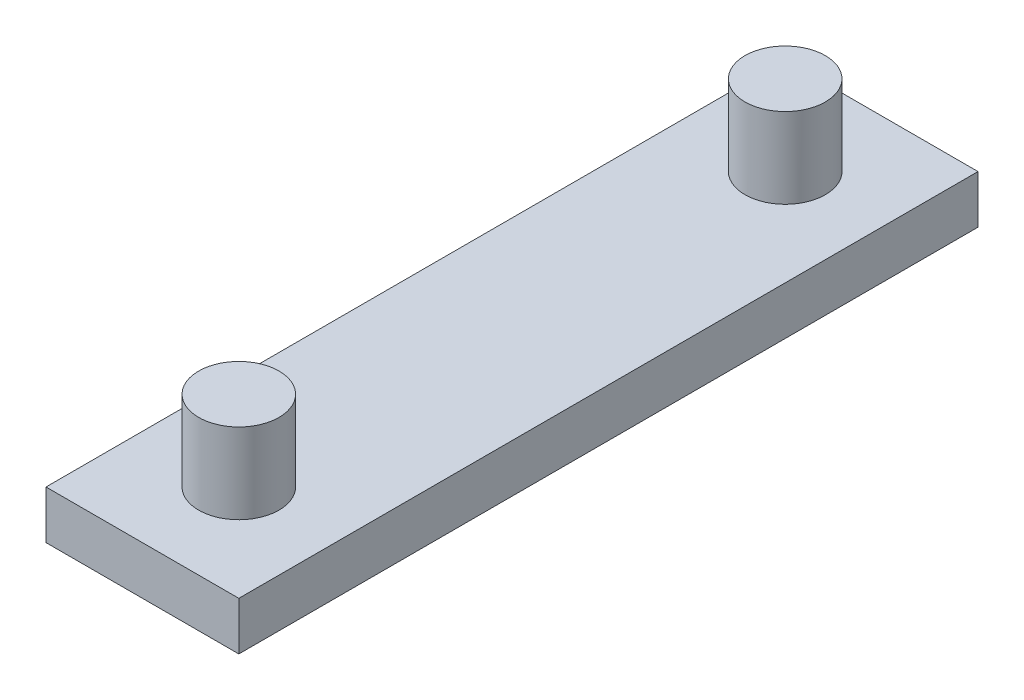
from build123d import *

# Parameters (mm, degrees)
SKETCH3_R             = 2.5
BOSS_EXTRUDE4_DEPTH   = 8
BOSS_EXTRUDE4_2_DEPTH = 8
SKETCH2_W             = 12
SKETCH2_H             = 46
BOSS_EXTRUDE5_DEPTH   = 3


with BuildPart() as part:
    # Sketch3 → Boss-Extrude4 (new body)
    with BuildSketch(Plane(origin=(0, 0, 0), x_dir=(1, 0, 0), z_dir=(0, 1, 0))):
        with Locations((-0.169934853, 17.143306367)):
            Circle(SKETCH3_R)
    extrude(amount=BOSS_EXTRUDE4_DEPTH)



with BuildPart() as body_2:
    # Sketch3 → Boss-Extrude4 2 (new body)
    with BuildSketch(Plane(origin=(0, 0, 0), x_dir=(1, 0, 0), z_dir=(0, 1, 0))):
        with Locations((-0.169934853, -16.856693633)):
            Circle(SKETCH3_R)
    extrude(amount=BOSS_EXTRUDE4_2_DEPTH)


with BuildPart() as part_1:
    add(part.part)

    add(body_2.part)  # Boss-Extrude5 merges body 2
    # Sketch2 → Boss-Extrude5 (add)
    with BuildSketch(Plane(origin=(0, 0, 0), x_dir=(1, 0, 0), z_dir=(0, 1, 0))):
        with Locations((-0.169934853, 0.143306367)):
            Rectangle(SKETCH2_W, SKETCH2_H)
    extrude(amount=BOSS_EXTRUDE5_DEPTH)


solid = part_1.part
